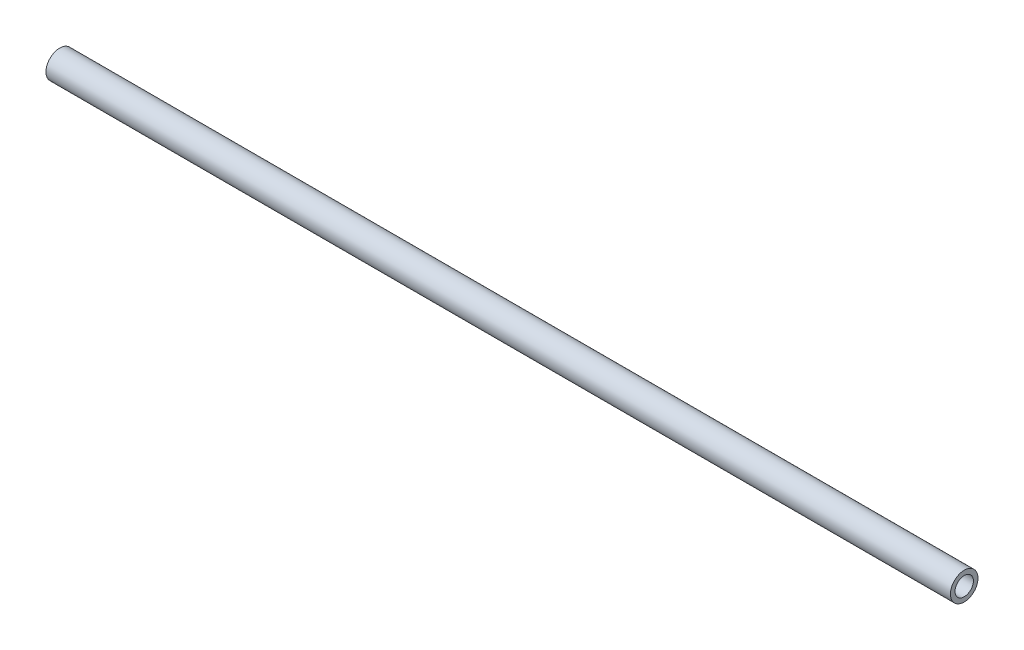
from build123d import *

# Parameters (mm, degrees)
SKETCH1_R           = 9.525
SKETCH1_R_2         = 6.35
BOSS_EXTRUDE1_DEPTH = 625.348


with BuildPart() as part:
    # Sketch1 → Boss-Extrude1 (new body)
    with BuildSketch(Plane(origin=(0, 0, 0), x_dir=(0, 0, -1), z_dir=(1, 0, 0))):
        Circle(SKETCH1_R)
        Circle(SKETCH1_R_2, mode=Mode.SUBTRACT)
    extrude(amount=BOSS_EXTRUDE1_DEPTH)


solid = part.part
